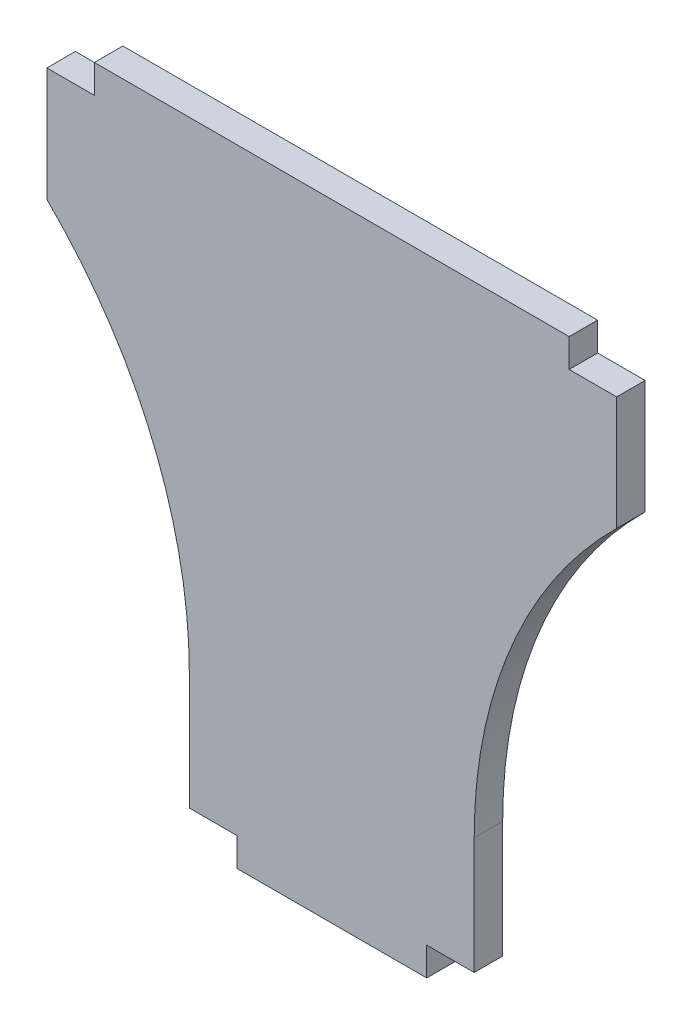
from build123d import *

# Parameters (mm, degrees)
BOSS_EXTRUDE1_DEPTH = 1.5
FILLET1_R           = 50


with BuildPart() as part:
    # Sketch2 → Boss-Extrude1 (new, symmetric)
    with BuildSketch(Plane.XY):
        Polygon((15, 24), (30, 24), (30, 36), (25, 36), (25, 39), (-25, 39), (-25, 36), (-30, 36), (-30, 24), (-15, 24), (-15, -24), (-10, -24), (-10, -27), (10, -27), (10, -24), (15, -24), align=None)
    extrude(amount=BOSS_EXTRUDE1_DEPTH, both=True)

    # Fillet1
    # the kernel refuses this fillet: 50 mm, written as the material it adds along each edge
    with BuildSketch(Plane(origin=(-15, 24, -1.5), x_dir=(0, -1, 0), z_dir=(0, 0, 1))) as fillet1_piece_1:
        with BuildLine():
            CenterArc((35.707142143, -50), FILLET1_R, 90, 45.572995999)
            Line((0, -15), (0, 0))
            Line((0, 0), (35.707142143, 0))
        make_face()
    extrude(amount=3)
    with BuildSketch(Plane(origin=(15, 24, 1.5), x_dir=(1, 0, 0), z_dir=(0, 0, -1))) as fillet1_piece_2:
        with BuildLine():
            CenterArc((50, 35.707142143), FILLET1_R, 180, 45.572995999)
            Line((0, 35.707142143), (0, 0))
            Line((0, 0), (15, 0))
        make_face()
    extrude(amount=3)


solid = part.part
